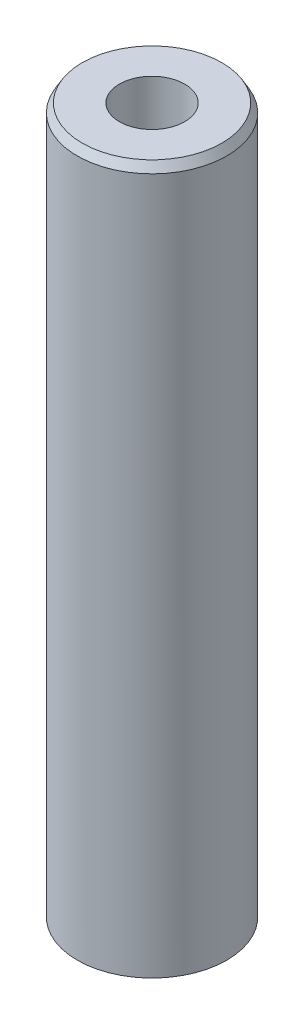
from build123d import *
from OCP.BRepFilletAPI import BRepFilletAPI_MakeChamfer

# Parameters (mm, degrees)
SKETCH1_R           = 45
BOSS_EXTRUDE1_DEPTH = 427.403267792
SKETCH2_R           = 19.650964063
CUT_EXTRUDE1_DEPTH  = 433.115208387
CHAMFER1_SIZE       = 5.18609941
CHAMFER1_SIZE2      = 2.99419589


with BuildPart() as part:
    # Sketch1 → Boss-Extrude1 (new body)
    with BuildSketch(Plane(origin=(0, 0, 0), x_dir=(1, 0, 0), z_dir=(0, 1, 0))):
        Circle(SKETCH1_R)
    extrude(amount=BOSS_EXTRUDE1_DEPTH)

    # Sketch2 → Cut-Extrude1 (cut, through all)
    with BuildSketch(Plane(origin=(0, 0, 0), x_dir=(1, 0, 0), z_dir=(0, 1, 0))):
        Circle(SKETCH2_R)
    extrude(amount=CUT_EXTRUDE1_DEPTH, mode=Mode.SUBTRACT)

    # Chamfer1: one chamfer whose edges measure the first distance from different faces: ONE call of the kernel's chamfer builder (chamfer() names one face for all edges)
    chamfer1_edges_1 = [part.edges().sort_by_distance(p)[0] for p in [
        (-45, 427.403267792, 0),
    ]]
    chamfer1_side_1 = [part.faces().sort_by_distance(p)[0] for p in [
        (-45, 213.701633896, 0),
    ]]
    chamfer1_edges_2 = [part.edges().sort_by_distance(p)[0] for p in [
        (-45, 0, 0),
    ]]
    chamfer1_side_2 = [part.faces().sort_by_distance(p)[0] for p in [
        (-43.727207794, 0, 0),
    ]]
    chamfer1 = BRepFilletAPI_MakeChamfer(part.part.solid().wrapped)
    for e in chamfer1_edges_1:
        chamfer1.Add(CHAMFER1_SIZE, CHAMFER1_SIZE2, e.wrapped, chamfer1_side_1[0].wrapped)  # the first distance lies on this face
    for e in chamfer1_edges_2:
        chamfer1.Add(CHAMFER1_SIZE, CHAMFER1_SIZE2, e.wrapped, chamfer1_side_2[0].wrapped)  # the first distance lies on this face
    add(Compound.cast(chamfer1.Shape()), mode=Mode.REPLACE)


solid = part.part
